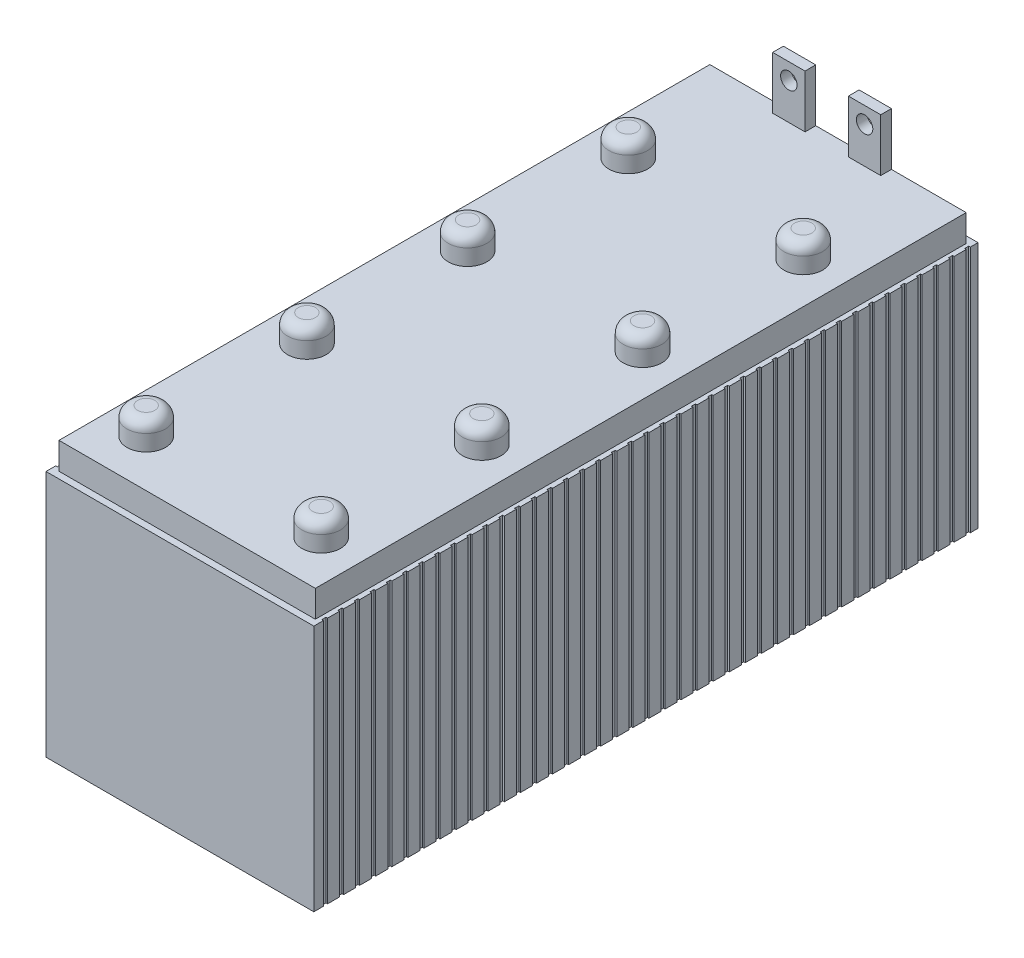
from build123d import *

# Parameters (mm, degrees)
SKETCH1_W                = 250
SKETCH1_H                = 620
BOSS_EXTRUDE1_DEPTH      = 231
SHELL1_T                 = -10
SKETCH2_W                = 239.300450152
SKETCH2_H                = 303.775056305
BOSS_EXTRUDE2_DEPTH      = 25
SKETCH3_R                = 18.057978688
BOSS_EXTRUDE3_DEPTH      = 25
FILLET1_R                = 10
LPATTERN1_COUNT          = 4
LPATTERN1_PITCH          = 150
FILLET1_OF_LPATTERN1_R   = 10
SKETCH4_W                = 30.202431125
SKETCH4_H                = 49.20031294
SKETCH4_R                = 7.685008541
BOSS_EXTRUDE4_DEPTH      = 10
SKETCH5_W                = 1.491996157
SKETCH5_H                = 3.791406127
CUT_EXTRUDE1_DEPTH       = 280
LPATTERN2_COUNT          = 41
LPATTERN2_PITCH          = 15
MIRROR4_COPY_1_SKETCH_W  = 1.491996157
MIRROR4_COPY_1_SKETCH_H  = 3.791406127
MIRROR4_COPY_1_DEPTH     = 280
MIRROR4_COPY_2_SKETCH_W  = 1.491996157
MIRROR4_COPY_2_SKETCH_H  = 3.791406127
MIRROR4_COPY_2_DEPTH     = 280
MIRROR4_COPY_3_SKETCH_W  = 1.491996157
MIRROR4_COPY_3_SKETCH_H  = 3.791406127
MIRROR4_COPY_3_DEPTH     = 280
MIRROR4_COPY_4_SKETCH_W  = 1.491996157
MIRROR4_COPY_4_SKETCH_H  = 3.791406127
MIRROR4_COPY_4_DEPTH     = 280
MIRROR4_COPY_5_SKETCH_W  = 1.491996157
MIRROR4_COPY_5_SKETCH_H  = 3.791406127
MIRROR4_COPY_5_DEPTH     = 280
MIRROR4_COPY_6_SKETCH_W  = 1.491996157
MIRROR4_COPY_6_SKETCH_H  = 3.791406127
MIRROR4_COPY_6_DEPTH     = 280
MIRROR4_COPY_7_SKETCH_W  = 1.491996157
MIRROR4_COPY_7_SKETCH_H  = 3.791406127
MIRROR4_COPY_7_DEPTH     = 280
MIRROR4_COPY_8_SKETCH_W  = 1.491996157
MIRROR4_COPY_8_SKETCH_H  = 3.791406127
MIRROR4_COPY_8_DEPTH     = 280
MIRROR4_COPY_9_SKETCH_W  = 1.491996157
MIRROR4_COPY_9_SKETCH_H  = 3.791406127
MIRROR4_COPY_9_DEPTH     = 280
MIRROR4_COPY_10_SKETCH_W = 1.491996157
MIRROR4_COPY_10_SKETCH_H = 3.791406127
MIRROR4_COPY_10_DEPTH    = 280
MIRROR4_COPY_11_SKETCH_W = 1.491996157
MIRROR4_COPY_11_SKETCH_H = 3.791406127
MIRROR4_COPY_11_DEPTH    = 280
MIRROR4_COPY_12_SKETCH_W = 1.491996157
MIRROR4_COPY_12_SKETCH_H = 3.791406127
MIRROR4_COPY_12_DEPTH    = 280
MIRROR4_COPY_13_SKETCH_W = 1.491996157
MIRROR4_COPY_13_SKETCH_H = 3.791406127
MIRROR4_COPY_13_DEPTH    = 280
MIRROR4_COPY_14_SKETCH_W = 1.491996157
MIRROR4_COPY_14_SKETCH_H = 3.791406127
MIRROR4_COPY_14_DEPTH    = 280
MIRROR4_COPY_15_SKETCH_W = 1.491996157
MIRROR4_COPY_15_SKETCH_H = 3.791406127
MIRROR4_COPY_15_DEPTH    = 280
MIRROR4_COPY_16_SKETCH_W = 1.491996157
MIRROR4_COPY_16_SKETCH_H = 3.791406127
MIRROR4_COPY_16_DEPTH    = 280
MIRROR4_COPY_17_SKETCH_W = 1.491996157
MIRROR4_COPY_17_SKETCH_H = 3.791406127
MIRROR4_COPY_17_DEPTH    = 280
MIRROR4_COPY_18_SKETCH_W = 1.491996157
MIRROR4_COPY_18_SKETCH_H = 3.791406127
MIRROR4_COPY_18_DEPTH    = 280
MIRROR4_COPY_19_SKETCH_W = 1.491996157
MIRROR4_COPY_19_SKETCH_H = 3.791406127
MIRROR4_COPY_19_DEPTH    = 280
MIRROR4_COPY_20_SKETCH_W = 1.491996157
MIRROR4_COPY_20_SKETCH_H = 3.791406127
MIRROR4_COPY_20_DEPTH    = 280
MIRROR4_COPY_21_SKETCH_W = 1.491996157
MIRROR4_COPY_21_SKETCH_H = 3.791406127
MIRROR4_COPY_21_DEPTH    = 280
MIRROR4_COPY_22_SKETCH_W = 1.491996157
MIRROR4_COPY_22_SKETCH_H = 3.791406127
MIRROR4_COPY_22_DEPTH    = 280
MIRROR4_COPY_23_SKETCH_W = 1.491996157
MIRROR4_COPY_23_SKETCH_H = 3.791406127
MIRROR4_COPY_23_DEPTH    = 280
MIRROR4_COPY_24_SKETCH_W = 1.491996157
MIRROR4_COPY_24_SKETCH_H = 3.791406127
MIRROR4_COPY_24_DEPTH    = 280
MIRROR4_COPY_25_SKETCH_W = 1.491996157
MIRROR4_COPY_25_SKETCH_H = 3.791406127
MIRROR4_COPY_25_DEPTH    = 280
MIRROR4_COPY_26_SKETCH_W = 1.491996157
MIRROR4_COPY_26_SKETCH_H = 3.791406127
MIRROR4_COPY_26_DEPTH    = 280
MIRROR4_COPY_27_SKETCH_W = 1.491996157
MIRROR4_COPY_27_SKETCH_H = 3.791406127
MIRROR4_COPY_27_DEPTH    = 280
MIRROR4_COPY_28_SKETCH_W = 1.491996157
MIRROR4_COPY_28_SKETCH_H = 3.791406127
MIRROR4_COPY_28_DEPTH    = 280
MIRROR4_COPY_29_SKETCH_W = 1.491996157
MIRROR4_COPY_29_SKETCH_H = 3.791406127
MIRROR4_COPY_29_DEPTH    = 280
MIRROR4_COPY_30_SKETCH_W = 1.491996157
MIRROR4_COPY_30_SKETCH_H = 3.791406127
MIRROR4_COPY_30_DEPTH    = 280
MIRROR4_COPY_31_SKETCH_W = 1.491996157
MIRROR4_COPY_31_SKETCH_H = 3.791406127
MIRROR4_COPY_31_DEPTH    = 280
MIRROR4_COPY_32_SKETCH_W = 1.491996157
MIRROR4_COPY_32_SKETCH_H = 3.791406127
MIRROR4_COPY_32_DEPTH    = 280
MIRROR4_COPY_33_SKETCH_W = 1.491996157
MIRROR4_COPY_33_SKETCH_H = 3.791406127
MIRROR4_COPY_33_DEPTH    = 280
MIRROR4_COPY_34_SKETCH_W = 1.491996157
MIRROR4_COPY_34_SKETCH_H = 3.791406127
MIRROR4_COPY_34_DEPTH    = 280
MIRROR4_COPY_35_SKETCH_W = 1.491996157
MIRROR4_COPY_35_SKETCH_H = 3.791406127
MIRROR4_COPY_35_DEPTH    = 280
MIRROR4_COPY_36_SKETCH_W = 1.491996157
MIRROR4_COPY_36_SKETCH_H = 3.791406127
MIRROR4_COPY_36_DEPTH    = 280
MIRROR4_COPY_37_SKETCH_W = 1.491996157
MIRROR4_COPY_37_SKETCH_H = 3.791406127
MIRROR4_COPY_37_DEPTH    = 280
MIRROR4_COPY_38_SKETCH_W = 1.491996157
MIRROR4_COPY_38_SKETCH_H = 3.791406127
MIRROR4_COPY_38_DEPTH    = 280
MIRROR4_COPY_39_SKETCH_W = 1.491996157
MIRROR4_COPY_39_SKETCH_H = 3.791406127
MIRROR4_COPY_39_DEPTH    = 280
MIRROR4_COPY_40_SKETCH_W = 1.491996157
MIRROR4_COPY_40_SKETCH_H = 3.791406127
MIRROR4_COPY_40_DEPTH    = 280


# Read off the part's stored shape, not the designer's step: Mirror2
with BuildPart() as part:
    # Sketch1 → Boss-Extrude1 (new body)
    with BuildSketch(Plane(origin=(0, 0, 0), x_dir=(1, 0, 0), z_dir=(0, 1, 0))):
        Rectangle(SKETCH1_W, SKETCH1_H)
    extrude(amount=BOSS_EXTRUDE1_DEPTH)

    # Shell1
    shell1_openings = [part.faces().sort_by_distance(p)[0] for p in [
        (0, 231, 0),
    ]]
    offset(amount=SHELL1_T, openings=shell1_openings, kind=Kind.INTERSECTION)

    # Sketch2 → Boss-Extrude2 (add)
    with BuildSketch(Plane(origin=(0, 231, 0), x_dir=(1, 0, 0), z_dir=(0, 1, 0))):
        with Locations((0.551518347, 151.887528153)):
            Rectangle(SKETCH2_W, SKETCH2_H)
    boss_extrude2 = extrude(amount=BOSS_EXTRUDE2_DEPTH)

    # Mirror1: Boss-Extrude2 across plane
    add(boss_extrude2.mirror(Plane.XY))

    # Sketch3 → Boss-Extrude3 (add)
    with BuildSketch(Plane(origin=(0, 256, 0), x_dir=(1, 0, 0), z_dir=(0, 1, 0))):
        with Locations(Location((-81.667603138, -259.787168788, 0), (0, 0, 270))):
            Circle(SKETCH3_R)
    boss_extrude3 = extrude(amount=BOSS_EXTRUDE3_DEPTH)

    # Fillet1
    fillet1_edges = [part.edges().sort_by_distance(p)[0] for p in [
        (-81.667603138, 281, 241.7291901),
    ]]
    fillet(fillet1_edges, radius=FILLET1_R)

    # LPattern1: Boss-Extrude3 ×4
    with Locations(*[(0, 0, -i * LPATTERN1_PITCH) for i in range(1, LPATTERN1_COUNT)]):
        add(boss_extrude3)

    # Fillet1 of LPattern1
    fillet1_of_lpattern1_edges = [part.edges().sort_by_distance(p)[0] for p in [
        (-81.667603138, 281, 91.7291901),
        (-81.667603138, 281, -58.2708099),
        (-81.667603138, 281, -208.2708099),
    ]]
    fillet(fillet1_of_lpattern1_edges, radius=FILLET1_OF_LPATTERN1_R)

    # Mirror2 outline → Mirror2 (revolve)
    with BuildSketch(Plane(origin=(81.667603138, 0, 259.787168788), x_dir=(1, 0, 0), z_dir=(0, 0, 1))):
        with BuildLine():
            Line((8.057978688, 281), (0, 281))
            Line((0, 281), (0, 256))
            Line((0, 256), (18.057978688, 256))
            Line((18.057978688, 256), (18.057978688, 271))
            ThreePointArc((18.057978688, 271), (15.1290465, 278.071067812), (8.057978688, 281))
        make_face()
    revolve(axis=Axis((81.667603138, 0, 259.787168788), (0, 1, 0)))

    # Mirror2 2 outline → Mirror2 2 (revolve)
    with BuildSketch(Plane(origin=(81.667603138, 0, 109.787168788), x_dir=(1, 0, 0), z_dir=(0, 0, 1))):
        with BuildLine():
            Line((8.057978688, 281), (0, 281))
            Line((0, 281), (0, 256))
            Line((0, 256), (18.057978688, 256))
            Line((18.057978688, 256), (18.057978688, 271))
            ThreePointArc((18.057978688, 271), (15.1290465, 278.071067812), (8.057978688, 281))
        make_face()
    revolve(axis=Axis((81.667603138, 0, 109.787168788), (0, 1, 0)))

    # Mirror2 3 outline → Mirror2 3 (revolve)
    with BuildSketch(Plane(origin=(81.667603138, 0, -40.212831212), x_dir=(1, 0, 0), z_dir=(0, 0, 1))):
        with BuildLine():
            Line((8.057978688, 281), (0, 281))
            Line((0, 281), (0, 256))
            Line((0, 256), (18.057978688, 256))
            Line((18.057978688, 256), (18.057978688, 271))
            ThreePointArc((18.057978688, 271), (15.1290465, 278.071067812), (8.057978688, 281))
        make_face()
    revolve(axis=Axis((81.667603138, 0, -40.212831212), (0, 1, 0)))

    # Mirror2 4 outline → Mirror2 4 (revolve)
    with BuildSketch(Plane(origin=(81.667603138, 0, -190.212831212), x_dir=(1, 0, 0), z_dir=(0, 0, 1))):
        with BuildLine():
            Line((8.057978688, 281), (0, 281))
            Line((0, 281), (0, 256))
            Line((0, 256), (18.057978688, 256))
            Line((18.057978688, 256), (18.057978688, 271))
            ThreePointArc((18.057978688, 271), (15.1290465, 278.071067812), (8.057978688, 281))
        make_face()
    revolve(axis=Axis((81.667603138, 0, -190.212831212), (0, 1, 0)))

    # Sketch4 → Boss-Extrude4 (add)
    with BuildSketch(Plane(origin=(0, 0, -303.775056305), x_dir=(-1, 0, 0), z_dir=(0, 0, -1))):
        with Locations((-35.338905164, 280.60015647)):
            Rectangle(SKETCH4_W, SKETCH4_H)
        with Locations((-35.338905164, 289.967782459)):
            Circle(SKETCH4_R, mode=Mode.SUBTRACT)
    boss_extrude4 = extrude(amount=-BOSS_EXTRUDE4_DEPTH)

    # Mirror3: Boss-Extrude4 across plane
    add(boss_extrude4.mirror(Plane(origin=(0, 0, 0), x_dir=(0, 0, 1), z_dir=(1, 0, 0))))

    # Sketch5 → Cut-Extrude1 (cut)
    with BuildSketch(Plane.XZ):
        with Locations((124.254001922, 299.084049941)):
            Rectangle(SKETCH5_W, SKETCH5_H)
    cut_extrude1 = extrude(amount=-CUT_EXTRUDE1_DEPTH, mode=Mode.SUBTRACT)

    # LPattern2: Cut-Extrude1 ×41
    with Locations(*[(0, 0, -i * LPATTERN2_PITCH) for i in range(1, LPATTERN2_COUNT)]):
        add(cut_extrude1, mode=Mode.SUBTRACT)

    # Mirror4: Cut-Extrude1 across plane
    add(cut_extrude1.mirror(Plane(origin=(0, 0, 0), x_dir=(0, 0, 1), z_dir=(1, 0, 0))), mode=Mode.SUBTRACT)

    # Mirror4 copy 1 sketch → Mirror4 copy 1 (cut)
    with BuildSketch(Plane(origin=(0, 0, -15), x_dir=(-1, 0, 0), z_dir=(0, -1, 0))):
        with Locations((124.254001922, -299.084049941)):
            Rectangle(MIRROR4_COPY_1_SKETCH_W, MIRROR4_COPY_1_SKETCH_H)
    extrude(amount=-MIRROR4_COPY_1_DEPTH, mode=Mode.SUBTRACT)

    # Mirror4 copy 2 sketch → Mirror4 copy 2 (cut)
    with BuildSketch(Plane(origin=(0, 0, -30), x_dir=(-1, 0, 0), z_dir=(0, -1, 0))):
        with Locations((124.254001922, -299.084049941)):
            Rectangle(MIRROR4_COPY_2_SKETCH_W, MIRROR4_COPY_2_SKETCH_H)
    extrude(amount=-MIRROR4_COPY_2_DEPTH, mode=Mode.SUBTRACT)

    # Mirror4 copy 3 sketch → Mirror4 copy 3 (cut)
    with BuildSketch(Plane(origin=(0, 0, -45), x_dir=(-1, 0, 0), z_dir=(0, -1, 0))):
        with Locations((124.254001922, -299.084049941)):
            Rectangle(MIRROR4_COPY_3_SKETCH_W, MIRROR4_COPY_3_SKETCH_H)
    extrude(amount=-MIRROR4_COPY_3_DEPTH, mode=Mode.SUBTRACT)

    # Mirror4 copy 4 sketch → Mirror4 copy 4 (cut)
    with BuildSketch(Plane(origin=(0, 0, -60), x_dir=(-1, 0, 0), z_dir=(0, -1, 0))):
        with Locations((124.254001922, -299.084049941)):
            Rectangle(MIRROR4_COPY_4_SKETCH_W, MIRROR4_COPY_4_SKETCH_H)
    extrude(amount=-MIRROR4_COPY_4_DEPTH, mode=Mode.SUBTRACT)

    # Mirror4 copy 5 sketch → Mirror4 copy 5 (cut)
    with BuildSketch(Plane(origin=(0, 0, -75), x_dir=(-1, 0, 0), z_dir=(0, -1, 0))):
        with Locations((124.254001922, -299.084049941)):
            Rectangle(MIRROR4_COPY_5_SKETCH_W, MIRROR4_COPY_5_SKETCH_H)
    extrude(amount=-MIRROR4_COPY_5_DEPTH, mode=Mode.SUBTRACT)

    # Mirror4 copy 6 sketch → Mirror4 copy 6 (cut)
    with BuildSketch(Plane(origin=(0, 0, -90), x_dir=(-1, 0, 0), z_dir=(0, -1, 0))):
        with Locations((124.254001922, -299.084049941)):
            Rectangle(MIRROR4_COPY_6_SKETCH_W, MIRROR4_COPY_6_SKETCH_H)
    extrude(amount=-MIRROR4_COPY_6_DEPTH, mode=Mode.SUBTRACT)

    # Mirror4 copy 7 sketch → Mirror4 copy 7 (cut)
    with BuildSketch(Plane(origin=(0, 0, -105), x_dir=(-1, 0, 0), z_dir=(0, -1, 0))):
        with Locations((124.254001922, -299.084049941)):
            Rectangle(MIRROR4_COPY_7_SKETCH_W, MIRROR4_COPY_7_SKETCH_H)
    extrude(amount=-MIRROR4_COPY_7_DEPTH, mode=Mode.SUBTRACT)

    # Mirror4 copy 8 sketch → Mirror4 copy 8 (cut)
    with BuildSketch(Plane(origin=(0, 0, -120), x_dir=(-1, 0, 0), z_dir=(0, -1, 0))):
        with Locations((124.254001922, -299.084049941)):
            Rectangle(MIRROR4_COPY_8_SKETCH_W, MIRROR4_COPY_8_SKETCH_H)
    extrude(amount=-MIRROR4_COPY_8_DEPTH, mode=Mode.SUBTRACT)

    # Mirror4 copy 9 sketch → Mirror4 copy 9 (cut)
    with BuildSketch(Plane(origin=(0, 0, -135), x_dir=(-1, 0, 0), z_dir=(0, -1, 0))):
        with Locations((124.254001922, -299.084049941)):
            Rectangle(MIRROR4_COPY_9_SKETCH_W, MIRROR4_COPY_9_SKETCH_H)
    extrude(amount=-MIRROR4_COPY_9_DEPTH, mode=Mode.SUBTRACT)

    # Mirror4 copy 10 sketch → Mirror4 copy 10 (cut)
    with BuildSketch(Plane(origin=(0, 0, -150), x_dir=(-1, 0, 0), z_dir=(0, -1, 0))):
        with Locations((124.254001922, -299.084049941)):
            Rectangle(MIRROR4_COPY_10_SKETCH_W, MIRROR4_COPY_10_SKETCH_H)
    extrude(amount=-MIRROR4_COPY_10_DEPTH, mode=Mode.SUBTRACT)

    # Mirror4 copy 11 sketch → Mirror4 copy 11 (cut)
    with BuildSketch(Plane(origin=(0, 0, -165), x_dir=(-1, 0, 0), z_dir=(0, -1, 0))):
        with Locations((124.254001922, -299.084049941)):
            Rectangle(MIRROR4_COPY_11_SKETCH_W, MIRROR4_COPY_11_SKETCH_H)
    extrude(amount=-MIRROR4_COPY_11_DEPTH, mode=Mode.SUBTRACT)

    # Mirror4 copy 12 sketch → Mirror4 copy 12 (cut)
    with BuildSketch(Plane(origin=(0, 0, -180), x_dir=(-1, 0, 0), z_dir=(0, -1, 0))):
        with Locations((124.254001922, -299.084049941)):
            Rectangle(MIRROR4_COPY_12_SKETCH_W, MIRROR4_COPY_12_SKETCH_H)
    extrude(amount=-MIRROR4_COPY_12_DEPTH, mode=Mode.SUBTRACT)

    # Mirror4 copy 13 sketch → Mirror4 copy 13 (cut)
    with BuildSketch(Plane(origin=(0, 0, -195), x_dir=(-1, 0, 0), z_dir=(0, -1, 0))):
        with Locations((124.254001922, -299.084049941)):
            Rectangle(MIRROR4_COPY_13_SKETCH_W, MIRROR4_COPY_13_SKETCH_H)
    extrude(amount=-MIRROR4_COPY_13_DEPTH, mode=Mode.SUBTRACT)

    # Mirror4 copy 14 sketch → Mirror4 copy 14 (cut)
    with BuildSketch(Plane(origin=(0, 0, -210), x_dir=(-1, 0, 0), z_dir=(0, -1, 0))):
        with Locations((124.254001922, -299.084049941)):
            Rectangle(MIRROR4_COPY_14_SKETCH_W, MIRROR4_COPY_14_SKETCH_H)
    extrude(amount=-MIRROR4_COPY_14_DEPTH, mode=Mode.SUBTRACT)

    # Mirror4 copy 15 sketch → Mirror4 copy 15 (cut)
    with BuildSketch(Plane(origin=(0, 0, -225), x_dir=(-1, 0, 0), z_dir=(0, -1, 0))):
        with Locations((124.254001922, -299.084049941)):
            Rectangle(MIRROR4_COPY_15_SKETCH_W, MIRROR4_COPY_15_SKETCH_H)
    extrude(amount=-MIRROR4_COPY_15_DEPTH, mode=Mode.SUBTRACT)

    # Mirror4 copy 16 sketch → Mirror4 copy 16 (cut)
    with BuildSketch(Plane(origin=(0, 0, -240), x_dir=(-1, 0, 0), z_dir=(0, -1, 0))):
        with Locations((124.254001922, -299.084049941)):
            Rectangle(MIRROR4_COPY_16_SKETCH_W, MIRROR4_COPY_16_SKETCH_H)
    extrude(amount=-MIRROR4_COPY_16_DEPTH, mode=Mode.SUBTRACT)

    # Mirror4 copy 17 sketch → Mirror4 copy 17 (cut)
    with BuildSketch(Plane(origin=(0, 0, -255), x_dir=(-1, 0, 0), z_dir=(0, -1, 0))):
        with Locations((124.254001922, -299.084049941)):
            Rectangle(MIRROR4_COPY_17_SKETCH_W, MIRROR4_COPY_17_SKETCH_H)
    extrude(amount=-MIRROR4_COPY_17_DEPTH, mode=Mode.SUBTRACT)

    # Mirror4 copy 18 sketch → Mirror4 copy 18 (cut)
    with BuildSketch(Plane(origin=(0, 0, -270), x_dir=(-1, 0, 0), z_dir=(0, -1, 0))):
        with Locations((124.254001922, -299.084049941)):
            Rectangle(MIRROR4_COPY_18_SKETCH_W, MIRROR4_COPY_18_SKETCH_H)
    extrude(amount=-MIRROR4_COPY_18_DEPTH, mode=Mode.SUBTRACT)

    # Mirror4 copy 19 sketch → Mirror4 copy 19 (cut)
    with BuildSketch(Plane(origin=(0, 0, -285), x_dir=(-1, 0, 0), z_dir=(0, -1, 0))):
        with Locations((124.254001922, -299.084049941)):
            Rectangle(MIRROR4_COPY_19_SKETCH_W, MIRROR4_COPY_19_SKETCH_H)
    extrude(amount=-MIRROR4_COPY_19_DEPTH, mode=Mode.SUBTRACT)

    # Mirror4 copy 20 sketch → Mirror4 copy 20 (cut)
    with BuildSketch(Plane(origin=(0, 0, -300), x_dir=(-1, 0, 0), z_dir=(0, -1, 0))):
        with Locations((124.254001922, -299.084049941)):
            Rectangle(MIRROR4_COPY_20_SKETCH_W, MIRROR4_COPY_20_SKETCH_H)
    extrude(amount=-MIRROR4_COPY_20_DEPTH, mode=Mode.SUBTRACT)

    # Mirror4 copy 21 sketch → Mirror4 copy 21 (cut)
    with BuildSketch(Plane(origin=(0, 0, -315), x_dir=(-1, 0, 0), z_dir=(0, -1, 0))):
        with Locations((124.254001922, -299.084049941)):
            Rectangle(MIRROR4_COPY_21_SKETCH_W, MIRROR4_COPY_21_SKETCH_H)
    extrude(amount=-MIRROR4_COPY_21_DEPTH, mode=Mode.SUBTRACT)

    # Mirror4 copy 22 sketch → Mirror4 copy 22 (cut)
    with BuildSketch(Plane(origin=(0, 0, -330), x_dir=(-1, 0, 0), z_dir=(0, -1, 0))):
        with Locations((124.254001922, -299.084049941)):
            Rectangle(MIRROR4_COPY_22_SKETCH_W, MIRROR4_COPY_22_SKETCH_H)
    extrude(amount=-MIRROR4_COPY_22_DEPTH, mode=Mode.SUBTRACT)

    # Mirror4 copy 23 sketch → Mirror4 copy 23 (cut)
    with BuildSketch(Plane(origin=(0, 0, -345), x_dir=(-1, 0, 0), z_dir=(0, -1, 0))):
        with Locations((124.254001922, -299.084049941)):
            Rectangle(MIRROR4_COPY_23_SKETCH_W, MIRROR4_COPY_23_SKETCH_H)
    extrude(amount=-MIRROR4_COPY_23_DEPTH, mode=Mode.SUBTRACT)

    # Mirror4 copy 24 sketch → Mirror4 copy 24 (cut)
    with BuildSketch(Plane(origin=(0, 0, -360), x_dir=(-1, 0, 0), z_dir=(0, -1, 0))):
        with Locations((124.254001922, -299.084049941)):
            Rectangle(MIRROR4_COPY_24_SKETCH_W, MIRROR4_COPY_24_SKETCH_H)
    extrude(amount=-MIRROR4_COPY_24_DEPTH, mode=Mode.SUBTRACT)

    # Mirror4 copy 25 sketch → Mirror4 copy 25 (cut)
    with BuildSketch(Plane(origin=(0, 0, -375), x_dir=(-1, 0, 0), z_dir=(0, -1, 0))):
        with Locations((124.254001922, -299.084049941)):
            Rectangle(MIRROR4_COPY_25_SKETCH_W, MIRROR4_COPY_25_SKETCH_H)
    extrude(amount=-MIRROR4_COPY_25_DEPTH, mode=Mode.SUBTRACT)

    # Mirror4 copy 26 sketch → Mirror4 copy 26 (cut)
    with BuildSketch(Plane(origin=(0, 0, -390), x_dir=(-1, 0, 0), z_dir=(0, -1, 0))):
        with Locations((124.254001922, -299.084049941)):
            Rectangle(MIRROR4_COPY_26_SKETCH_W, MIRROR4_COPY_26_SKETCH_H)
    extrude(amount=-MIRROR4_COPY_26_DEPTH, mode=Mode.SUBTRACT)

    # Mirror4 copy 27 sketch → Mirror4 copy 27 (cut)
    with BuildSketch(Plane(origin=(0, 0, -405), x_dir=(-1, 0, 0), z_dir=(0, -1, 0))):
        with Locations((124.254001922, -299.084049941)):
            Rectangle(MIRROR4_COPY_27_SKETCH_W, MIRROR4_COPY_27_SKETCH_H)
    extrude(amount=-MIRROR4_COPY_27_DEPTH, mode=Mode.SUBTRACT)

    # Mirror4 copy 28 sketch → Mirror4 copy 28 (cut)
    with BuildSketch(Plane(origin=(0, 0, -420), x_dir=(-1, 0, 0), z_dir=(0, -1, 0))):
        with Locations((124.254001922, -299.084049941)):
            Rectangle(MIRROR4_COPY_28_SKETCH_W, MIRROR4_COPY_28_SKETCH_H)
    extrude(amount=-MIRROR4_COPY_28_DEPTH, mode=Mode.SUBTRACT)

    # Mirror4 copy 29 sketch → Mirror4 copy 29 (cut)
    with BuildSketch(Plane(origin=(0, 0, -435), x_dir=(-1, 0, 0), z_dir=(0, -1, 0))):
        with Locations((124.254001922, -299.084049941)):
            Rectangle(MIRROR4_COPY_29_SKETCH_W, MIRROR4_COPY_29_SKETCH_H)
    extrude(amount=-MIRROR4_COPY_29_DEPTH, mode=Mode.SUBTRACT)

    # Mirror4 copy 30 sketch → Mirror4 copy 30 (cut)
    with BuildSketch(Plane(origin=(0, 0, -450), x_dir=(-1, 0, 0), z_dir=(0, -1, 0))):
        with Locations((124.254001922, -299.084049941)):
            Rectangle(MIRROR4_COPY_30_SKETCH_W, MIRROR4_COPY_30_SKETCH_H)
    extrude(amount=-MIRROR4_COPY_30_DEPTH, mode=Mode.SUBTRACT)

    # Mirror4 copy 31 sketch → Mirror4 copy 31 (cut)
    with BuildSketch(Plane(origin=(0, 0, -465), x_dir=(-1, 0, 0), z_dir=(0, -1, 0))):
        with Locations((124.254001922, -299.084049941)):
            Rectangle(MIRROR4_COPY_31_SKETCH_W, MIRROR4_COPY_31_SKETCH_H)
    extrude(amount=-MIRROR4_COPY_31_DEPTH, mode=Mode.SUBTRACT)

    # Mirror4 copy 32 sketch → Mirror4 copy 32 (cut)
    with BuildSketch(Plane(origin=(0, 0, -480), x_dir=(-1, 0, 0), z_dir=(0, -1, 0))):
        with Locations((124.254001922, -299.084049941)):
            Rectangle(MIRROR4_COPY_32_SKETCH_W, MIRROR4_COPY_32_SKETCH_H)
    extrude(amount=-MIRROR4_COPY_32_DEPTH, mode=Mode.SUBTRACT)

    # Mirror4 copy 33 sketch → Mirror4 copy 33 (cut)
    with BuildSketch(Plane(origin=(0, 0, -495), x_dir=(-1, 0, 0), z_dir=(0, -1, 0))):
        with Locations((124.254001922, -299.084049941)):
            Rectangle(MIRROR4_COPY_33_SKETCH_W, MIRROR4_COPY_33_SKETCH_H)
    extrude(amount=-MIRROR4_COPY_33_DEPTH, mode=Mode.SUBTRACT)

    # Mirror4 copy 34 sketch → Mirror4 copy 34 (cut)
    with BuildSketch(Plane(origin=(0, 0, -510), x_dir=(-1, 0, 0), z_dir=(0, -1, 0))):
        with Locations((124.254001922, -299.084049941)):
            Rectangle(MIRROR4_COPY_34_SKETCH_W, MIRROR4_COPY_34_SKETCH_H)
    extrude(amount=-MIRROR4_COPY_34_DEPTH, mode=Mode.SUBTRACT)

    # Mirror4 copy 35 sketch → Mirror4 copy 35 (cut)
    with BuildSketch(Plane(origin=(0, 0, -525), x_dir=(-1, 0, 0), z_dir=(0, -1, 0))):
        with Locations((124.254001922, -299.084049941)):
            Rectangle(MIRROR4_COPY_35_SKETCH_W, MIRROR4_COPY_35_SKETCH_H)
    extrude(amount=-MIRROR4_COPY_35_DEPTH, mode=Mode.SUBTRACT)

    # Mirror4 copy 36 sketch → Mirror4 copy 36 (cut)
    with BuildSketch(Plane(origin=(0, 0, -540), x_dir=(-1, 0, 0), z_dir=(0, -1, 0))):
        with Locations((124.254001922, -299.084049941)):
            Rectangle(MIRROR4_COPY_36_SKETCH_W, MIRROR4_COPY_36_SKETCH_H)
    extrude(amount=-MIRROR4_COPY_36_DEPTH, mode=Mode.SUBTRACT)

    # Mirror4 copy 37 sketch → Mirror4 copy 37 (cut)
    with BuildSketch(Plane(origin=(0, 0, -555), x_dir=(-1, 0, 0), z_dir=(0, -1, 0))):
        with Locations((124.254001922, -299.084049941)):
            Rectangle(MIRROR4_COPY_37_SKETCH_W, MIRROR4_COPY_37_SKETCH_H)
    extrude(amount=-MIRROR4_COPY_37_DEPTH, mode=Mode.SUBTRACT)

    # Mirror4 copy 38 sketch → Mirror4 copy 38 (cut)
    with BuildSketch(Plane(origin=(0, 0, -570), x_dir=(-1, 0, 0), z_dir=(0, -1, 0))):
        with Locations((124.254001922, -299.084049941)):
            Rectangle(MIRROR4_COPY_38_SKETCH_W, MIRROR4_COPY_38_SKETCH_H)
    extrude(amount=-MIRROR4_COPY_38_DEPTH, mode=Mode.SUBTRACT)

    # Mirror4 copy 39 sketch → Mirror4 copy 39 (cut)
    with BuildSketch(Plane(origin=(0, 0, -585), x_dir=(-1, 0, 0), z_dir=(0, -1, 0))):
        with Locations((124.254001922, -299.084049941)):
            Rectangle(MIRROR4_COPY_39_SKETCH_W, MIRROR4_COPY_39_SKETCH_H)
    extrude(amount=-MIRROR4_COPY_39_DEPTH, mode=Mode.SUBTRACT)

    # Mirror4 copy 40 sketch → Mirror4 copy 40 (cut)
    with BuildSketch(Plane(origin=(0, 0, -600), x_dir=(-1, 0, 0), z_dir=(0, -1, 0))):
        with Locations((124.254001922, -299.084049941)):
            Rectangle(MIRROR4_COPY_40_SKETCH_W, MIRROR4_COPY_40_SKETCH_H)
    extrude(amount=-MIRROR4_COPY_40_DEPTH, mode=Mode.SUBTRACT)


solid = part.part
